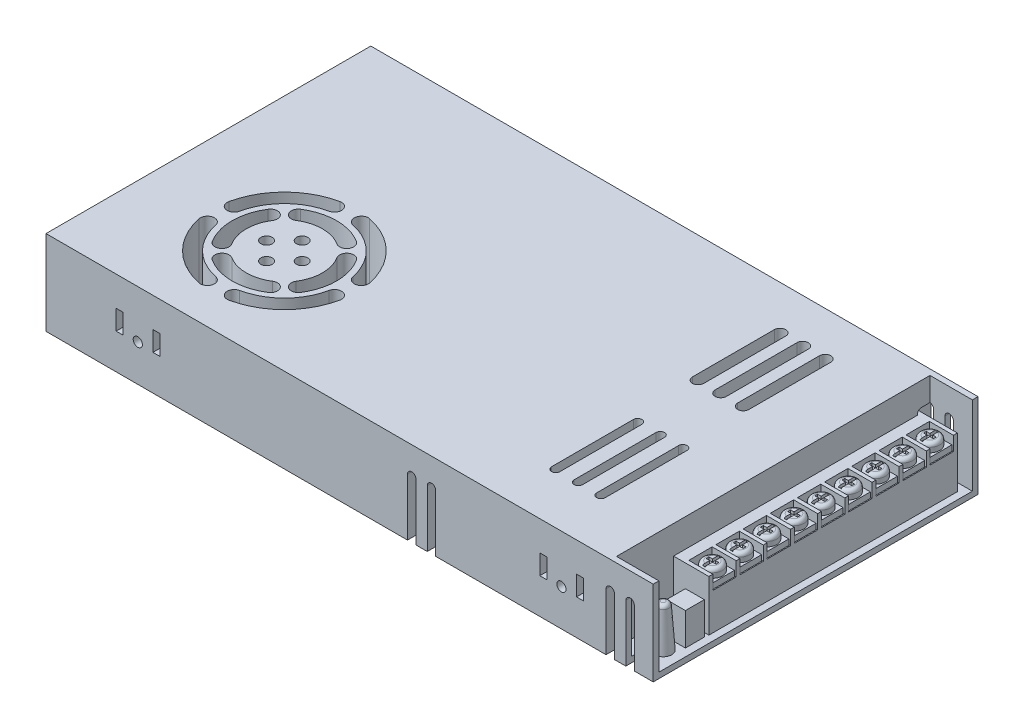
from build123d import *

# Parameters (mm, degrees)
CROQUIS1_W                         = 215
CROQUIS1_H                         = 115
SALIENTE_EXTRUIR1_DEPTH            = 30
CROQUIS2_W                         = 15
CROQUIS2_H                         = 111
CORTAR_EXTRUIR1_DEPTH              = 28
CROQUIS5_R                         = 1.625
CORTAR_EXTRUIR3_DEPTH              = 246.662369931
CORTAR_EXTRUIR5_DEPTH              = 28
CROQUIS10_W                        = 2.5
CROQUIS10_H                        = 7
CORTAR_EXTRUIR8_NO_CONFIRMAT_DEPTH = 246.662369931
CROQUIS11_W                        = 16
CROQUIS11_H                        = 88
SALIENTE_EXTRUIR2_DEPTH            = 20
CROQUIS12_W                        = 8.266666667
CROQUIS12_H                        = 5
CROQUIS12_W_2                      = 8.266666666
CORTAR_EXTRUIR11_DEPTH             = 8.5
CORTAR_EXTRUIR15_DEPTH             = 6.4
CUT_EXTRUDE2_START                 = -110
CUT_EXTRUDE2_DEPTH                 = 10
REDONDEO3_R                        = 1.3
CROQUIS18_R                        = 2
CORTAR_EXTRUIR17_DEPTH             = 28
CROQUIS28_R                        = 1.625
CORTAR_EXTRUIR23_DEPTH             = 2
CROQUIS29_R                        = 3.5
SALIENTE_EXTRUIR3_DEPTH            = 5
REDONDEO4_R                        = 1.3
CROQUIS30_W                        = 1
CROQUIS30_H                        = 6
CORTAR_EXTRUIR24_DEPTH             = 1
CROQUIS31_W                        = 3.5
CROQUIS31_H                        = 1
CORTAR_EXTRUIR25_DEPTH             = 1
CROQUIS32_W                        = 7.8
CROQUIS32_H                        = 7.8
SALIENTE_EXTRUIR4_DEPTH            = 2
MATRIZL1_COUNT                     = 9
MATRIZL1_PITCH                     = 9.62
CROQUIS34_W                        = 6.7
CROQUIS34_H                        = 6.7
SALIENTE_EXTRUIR5_DEPTH            = 11.5
CROQUIS35_R                        = 3
SALIENTE_EXTRUIR6_DEPTH            = 15
SALIENTE_EXTRUIR6_TAPER            = 4
REDONDEO5_R                        = 1.3


with BuildPart() as part:
    # Croquis1 → Saliente-Extruir1 (new body)
    with BuildSketch(Plane(origin=(0, 0, 0), x_dir=(1, 0, 0), z_dir=(0, 1, 0))):
        with Locations((107.5, 57.5)):
            Rectangle(CROQUIS1_W, CROQUIS1_H)
    extrude(amount=SALIENTE_EXTRUIR1_DEPTH)

    # Croquis2 → Cortar-Extruir1 (cut)
    with BuildSketch(Plane(origin=(0, 30, 0), x_dir=(1, 0, 0), z_dir=(0, 1, 0))):
        with Locations((207.5, 57.5)):
            Rectangle(CROQUIS2_W, CROQUIS2_H)
    extrude(amount=-CORTAR_EXTRUIR1_DEPTH, mode=Mode.SUBTRACT)

    # Croquis5 → Cortar-Extruir3 (cut, through all)
    with BuildSketch(Plane(origin=(0, 0, -115), x_dir=(-1, 0, 0), z_dir=(0, 0, -1))):
        with Locations((-182.5, 13)):
            Circle(CROQUIS5_R)
        with Locations((-32.5, 13)):
            Circle(CROQUIS5_R)
    extrude(amount=-CORTAR_EXTRUIR3_DEPTH, mode=Mode.SUBTRACT)

    # Croquis7 → Cortar-Extruir5 (cut)
    with BuildSketch(Plane(origin=(0, 30, 0), x_dir=(1, 0, 0), z_dir=(0, 1, 0))):
        with BuildLine():
            Line((178.4, 99.5), (178.4, 70.5))
            ThreePointArc((178.4, 70.5), (176.4, 68.5), (174.4, 70.5))
            Line((174.4, 70.5), (174.4, 99.5))
            ThreePointArc((174.4, 99.5), (176.4, 101.5), (178.4, 99.5))
        make_face()
        with BuildLine():
            Line((180, 47), (180, 18))
            ThreePointArc((180, 18), (178.5, 16.5), (177, 18))
            Line((177, 18), (177, 47))
            ThreePointArc((177, 47), (178.5, 48.5), (180, 47))
        make_face()
        with BuildLine():
            Line((170.4, 99.5), (170.4, 70.5))
            ThreePointArc((170.4, 70.5), (168.4, 68.5), (166.4, 70.5))
            Line((166.4, 70.5), (166.4, 99.5))
            ThreePointArc((166.4, 99.5), (168.4, 101.5), (170.4, 99.5))
        make_face()
        with BuildLine():
            Line((172, 47), (172, 18))
            ThreePointArc((172, 18), (170.5, 16.5), (169, 18))
            Line((169, 18), (169, 47))
            ThreePointArc((169, 47), (170.5, 48.5), (172, 47))
        make_face()
        with BuildLine():
            Line((162.4, 99.5), (162.4, 70.5))
            ThreePointArc((162.4, 70.5), (160.4, 68.5), (158.4, 70.5))
            Line((158.4, 70.5), (158.4, 99.5))
            ThreePointArc((158.4, 99.5), (160.4, 101.5), (162.4, 99.5))
        make_face()
        with BuildLine():
            Line((164, 47), (164, 18))
            ThreePointArc((164, 18), (162.5, 16.5), (161, 18))
            Line((161, 18), (161, 47))
            ThreePointArc((161, 47), (162.5, 48.5), (164, 47))
        make_face()
    extrude(amount=-CORTAR_EXTRUIR5_DEPTH, mode=Mode.SUBTRACT)

    # Croquis10 → Cortar-Extruir8 (no confirmat) (cut, through all)
    with BuildSketch(Plane(origin=(0, 0, -115), x_dir=(-1, 0, 0), z_dir=(0, 0, -1))):
        with Locations((-26.1, 16)):
            Rectangle(CROQUIS10_W, CROQUIS10_H)
        with Locations((-39.1, 16)):
            Rectangle(CROQUIS10_W, CROQUIS10_H)
        with Locations((-176.1, 16)):
            Rectangle(CROQUIS10_W, CROQUIS10_H)
        with Locations((-189.1, 16)):
            Rectangle(CROQUIS10_W, CROQUIS10_H)
    extrude(amount=-CORTAR_EXTRUIR8_NO_CONFIRMAT_DEPTH, mode=Mode.SUBTRACT)

    # Croquis17 → Cortar-Extruir15 (cut)
    with BuildSketch(Plane(origin=(0, 0, -115), x_dir=(-1, 0, 0), z_dir=(0, 0, -1))):
        with BuildLine():
            Line((-135, 20.2), (-135, 0))
            ThreePointArc((-135, 0), (-136.5, -1.5), (-138, 0))
            Line((-138, 0), (-138, 20.2))
            ThreePointArc((-138, 20.2), (-136.5, 21.7), (-135, 20.2))
        make_face()
        with BuildLine():
            Line((-128, 20.2), (-128, 0))
            ThreePointArc((-128, 0), (-129.5, -1.5), (-131, 0))
            Line((-131, 0), (-131, 20.2))
            ThreePointArc((-131, 20.2), (-129.5, 21.7), (-128, 20.2))
        make_face()
        with BuildLine():
            Line((-201.3, 0), (-201.3, 20.2))
            ThreePointArc((-201.3, 20.2), (-199.8, 21.7), (-198.3, 20.2))
            Line((-198.3, 20.2), (-198.3, 0))
            ThreePointArc((-198.3, 0), (-199.8, -1.5), (-201.3, 0))
        make_face()
        with BuildLine():
            Line((-208.3, 0), (-208.3, 20.2))
            ThreePointArc((-208.3, 20.2), (-206.8, 21.7), (-205.3, 20.2))
            Line((-205.3, 20.2), (-205.3, 0))
            ThreePointArc((-205.3, 0), (-206.8, -1.5), (-208.3, 0))
        make_face()
    extrude(amount=-CORTAR_EXTRUIR15_DEPTH, mode=Mode.SUBTRACT)

    # Croquis17<2> → Cut-Extrude2 (cut)
    with BuildSketch(Plane(origin=(0, 0, -115), x_dir=(-1, 0, 0), z_dir=(0, 0, -1)).offset(CUT_EXTRUDE2_START)):
        with BuildLine():
            Line((-135, 20.2), (-135, 0))
            ThreePointArc((-135, 0), (-136.5, -1.5), (-138, 0))
            Line((-138, 0), (-138, 20.2))
            ThreePointArc((-138, 20.2), (-136.5, 21.7), (-135, 20.2))
        make_face()
        with BuildLine():
            Line((-128, 20.2), (-128, 0))
            ThreePointArc((-128, 0), (-129.5, -1.5), (-131, 0))
            Line((-131, 0), (-131, 20.2))
            ThreePointArc((-131, 20.2), (-129.5, 21.7), (-128, 20.2))
        make_face()
        with BuildLine():
            Line((-201.3, 0), (-201.3, 20.2))
            ThreePointArc((-201.3, 20.2), (-199.8, 21.7), (-198.3, 20.2))
            Line((-198.3, 20.2), (-198.3, 0))
            ThreePointArc((-198.3, 0), (-199.8, -1.5), (-201.3, 0))
        make_face()
        with BuildLine():
            Line((-208.3, 0), (-208.3, 20.2))
            ThreePointArc((-208.3, 20.2), (-206.8, 21.7), (-205.3, 20.2))
            Line((-205.3, 20.2), (-205.3, 0))
            ThreePointArc((-205.3, 0), (-206.8, -1.5), (-208.3, 0))
        make_face()
    extrude(amount=-CUT_EXTRUDE2_DEPTH, mode=Mode.SUBTRACT)

    # Redondeo3
    redondeo3_edges = [part.edges().sort_by_distance(p)[0] for p in [
        (136.5, 21.7, -108.6),
        (135, 10.1, -108.6),
        (138, 10.1, -108.6),
        (129.5, 21.7, -108.6),
        (128, 10.1, -108.6),
        (131, 10.1, -108.6),
        (201.3, 1, -108.6),
        (198.812579117, 21.329158979, -108.6),
        (198.3, 10.1, -108.6),
        (208.3, 1, -108.6),
        (205.3, 1, -108.6),
        (135, 10.1, -5),
        (136.5, 21.7, -5),
        (138, 10.1, -5),
        (128, 10.1, -5),
        (129.5, 21.7, -5),
        (131, 10.1, -5),
        (198.3, 10.1, -5),
        (198.812579117, 21.329158979, -5),
        (201.3, 1, -5),
        (205.3, 1, -5),
        (208.3, 1, -5),
    ]]
    fillet(redondeo3_edges, radius=REDONDEO3_R - 0.0001)  # a hair under: the kernel refuses the full size

    # Croquis18 → Cortar-Extruir17 (cut)
    with BuildSketch(Plane(origin=(0, 30, 0), x_dir=(1, 0, 0), z_dir=(0, 1, 0))):
        with Locations(Location((41.2, 36.9, 0), (0, 0, 270))):
            Circle(CROQUIS18_R)
        with Locations(Location((47.5, 43.2, 0), (0, 0, 270))):
            Circle(CROQUIS18_R)
        with Locations(Location((53.8, 36.9, 0), (0, 0, 270))):
            Circle(CROQUIS18_R)
        with Locations(Location((47.5, 30.6, 0), (0, 0, 270))):
            Circle(CROQUIS18_R)
        with BuildLine():
            ThreePointArc((42.233695652, 61.850271311), (29.46877708, 54.93122292), (22.549728689, 42.166304348))
            ThreePointArc((22.549728689, 42.166304348), (24.479529404, 39.203894963), (27.441938763, 41.133695717))
            ThreePointArc((27.441938763, 41.133695717), (33.004311009, 51.395689038), (43.266304348, 56.95806125))
            ThreePointArc((43.266304348, 56.95806125), (45.196105031, 59.920470629), (42.233695652, 61.850271311))
        make_face()
        with BuildLine():
            ThreePointArc((67.55806125, 41.133695652), (61.995689038, 51.395688991), (51.733695717, 56.958061237))
            ThreePointArc((51.733695717, 56.958061237), (49.803894963, 59.920470596), (52.766304348, 61.850271311))
            ThreePointArc((52.766304348, 61.850271311), (65.53122292, 54.93122292), (72.450271311, 42.166304348))
            ThreePointArc((72.450271311, 42.166304348), (70.520470629, 39.203894969), (67.55806125, 41.133695652))
        make_face()
        with BuildLine():
            ThreePointArc((51.733695652, 16.84193875), (61.995688991, 22.404310962), (67.558061237, 32.666304283))
            ThreePointArc((67.558061237, 32.666304283), (70.520470596, 34.596105037), (72.450271311, 31.633695652))
            ThreePointArc((72.450271311, 31.633695652), (65.53122292, 18.86877708), (52.766304348, 11.949728689))
            ThreePointArc((52.766304348, 11.949728689), (49.803894969, 13.879529371), (51.733695652, 16.84193875))
        make_face()
        with BuildLine():
            ThreePointArc((27.44193875, 32.666304348), (33.004310962, 22.404311009), (43.266304283, 16.841938763))
            ThreePointArc((43.266304283, 16.841938763), (45.196105037, 13.879529404), (42.233695652, 11.949728689))
            ThreePointArc((42.233695652, 11.949728689), (29.46877708, 18.86877708), (22.549728689, 31.633695652))
            ThreePointArc((22.549728689, 31.633695652), (24.479529371, 34.596105031), (27.44193875, 32.666304348))
        make_face()
        with BuildLine():
            ThreePointArc((31.873772868, 46.803081622), (29, 36.9), (31.873772868, 26.996918378))
            ThreePointArc((31.873772868, 26.996918378), (35.323679456, 26.223520336), (36.097077498, 29.673426924))
            ThreePointArc((36.097077498, 29.673426924), (34, 36.9), (36.097077498, 44.126573076))
            ThreePointArc((36.097077498, 44.126573076), (35.323679456, 47.576479664), (31.873772868, 46.803081622))
        make_face()
        with BuildLine():
            ThreePointArc((57.403081622, 52.526227132), (47.5, 55.4), (37.596918378, 52.526227132))
            ThreePointArc((37.596918378, 52.526227132), (36.823520336, 49.076320544), (40.273426924, 48.302922502))
            ThreePointArc((40.273426924, 48.302922502), (47.5, 50.4), (54.726573076, 48.302922502))
            ThreePointArc((54.726573076, 48.302922502), (58.176479664, 49.076320544), (57.403081622, 52.526227132))
        make_face()
        with BuildLine():
            ThreePointArc((63.126227132, 26.996918378), (66, 36.9), (63.126227132, 46.803081622))
            ThreePointArc((63.126227132, 46.803081622), (59.676320544, 47.576479664), (58.902922502, 44.126573076))
            ThreePointArc((58.902922502, 44.126573076), (61, 36.9), (58.902922502, 29.673426924))
            ThreePointArc((58.902922502, 29.673426924), (59.676320544, 26.223520336), (63.126227132, 26.996918378))
        make_face()
        with BuildLine():
            ThreePointArc((37.596918378, 21.273772868), (47.5, 18.4), (57.403081622, 21.273772868))
            ThreePointArc((57.403081622, 21.273772868), (58.176479664, 24.723679456), (54.726573076, 25.497077498))
            ThreePointArc((54.726573076, 25.497077498), (47.5, 23.4), (40.273426924, 25.497077498))
            ThreePointArc((40.273426924, 25.497077498), (36.823520336, 24.723679456), (37.596918378, 21.273772868))
        make_face()
    extrude(amount=-CORTAR_EXTRUIR17_DEPTH, mode=Mode.SUBTRACT)

    # Croquis28 → Cortar-Extruir23 (cut)
    with BuildSketch(Plane.XZ):
        with Locations(Location((30, -32.5, 0), (0, 0, 270))):
            Circle(CROQUIS28_R)
        with Locations(Location((30, -82.5, 0), (0, 0, 270))):
            Circle(CROQUIS28_R)
        with Locations(Location((180, -32.5, 0), (0, 0, 270))):
            Circle(CROQUIS28_R)
        with Locations(Location((180, -82.5, 0), (0, 0, 270))):
            Circle(CROQUIS28_R)
    extrude(amount=-CORTAR_EXTRUIR23_DEPTH, mode=Mode.SUBTRACT)


with BuildPart() as body_2:
    # Croquis11 → Saliente-Extruir2 (new body)
    with BuildSketch(Plane(origin=(0, 0, 0), x_dir=(1, 0, 0), z_dir=(0, 1, 0))):
        with Locations((204.5, 66.2)):
            Rectangle(CROQUIS11_W, CROQUIS11_H)
    extrude(amount=SALIENTE_EXTRUIR2_DEPTH)

    # Croquis12 → Cortar-Extruir11 (cut)
    with BuildSketch(Plane(origin=(212.5, 0, 0), x_dir=(0, 0, -1), z_dir=(1, 0, 0))):
        with Locations((27.733333333, 17.5)):
            Rectangle(CROQUIS12_W, CROQUIS12_H)
        with Locations((37.35, 17.5)):
            Rectangle(CROQUIS12_W_2, CROQUIS12_H)
        with Locations((46.966666667, 17.5)):
            Rectangle(CROQUIS12_W, CROQUIS12_H)
        with Locations((56.583333334, 17.5)):
            Rectangle(CROQUIS12_W, CROQUIS12_H)
        with Locations((66.2, 17.5)):
            Rectangle(CROQUIS12_W_2, CROQUIS12_H)
        with Locations((75.816666666, 17.5)):
            Rectangle(CROQUIS12_W, CROQUIS12_H)
        with Locations((85.433333334, 17.5)):
            Rectangle(CROQUIS12_W, CROQUIS12_H)
        with Locations((95.05, 17.5)):
            Rectangle(CROQUIS12_W_2, CROQUIS12_H)
        with Locations((104.666666667, 17.5)):
            Rectangle(CROQUIS12_W, CROQUIS12_H)
    extrude(amount=-CORTAR_EXTRUIR11_DEPTH, mode=Mode.SUBTRACT)


with BuildPart() as body_3:
    # Croquis29 → Saliente-Extruir3 (new body)
    with BuildSketch(Plane(origin=(0, 15, 0), x_dir=(1, 0, 0), z_dir=(0, 1, 0))):
        with Locations(Location((208.25, 27.733333333, 0), (0, 0, 270))):
            Circle(CROQUIS29_R)
    extrude(amount=SALIENTE_EXTRUIR3_DEPTH)

    # Redondeo4
    redondeo4_edges = [body_3.edges().sort_by_distance(p)[0] for p in [
        (208.25, 20, -31.233333333),
    ]]
    fillet(redondeo4_edges, radius=REDONDEO4_R)

    # Croquis30 → Cortar-Extruir24 (cut)
    with BuildSketch(Plane(origin=(0, 20, 0), x_dir=(1, 0, 0), z_dir=(0, 1, 0))):
        with Locations((208.25, 27.733333333)):
            Rectangle(CROQUIS30_W, CROQUIS30_H)
    extrude(amount=-CORTAR_EXTRUIR24_DEPTH, mode=Mode.SUBTRACT)

    # Croquis31 → Cortar-Extruir25 (cut)
    with BuildSketch(Plane(origin=(0, 20, 0), x_dir=(1, 0, 0), z_dir=(0, 1, 0))):
        with Locations((208.25, 27.733333333)):
            Rectangle(CROQUIS31_W, CROQUIS31_H)
    extrude(amount=-CORTAR_EXTRUIR25_DEPTH, mode=Mode.SUBTRACT)

    # Croquis32 → Saliente-Extruir4 (add)
    with BuildSketch(Plane(origin=(0, 15, 0), x_dir=(1, 0, 0), z_dir=(0, 1, 0))):
        with Locations((208.25, 27.733333333)):
            Rectangle(CROQUIS32_W, CROQUIS32_H)
    extrude(amount=SALIENTE_EXTRUIR4_DEPTH)


with BuildPart() as matrizl1_1:
    # MatrizL1: pattern copy
    add(body_3.part.moved(Location(Vector(0, 0, -1) * (1 * MATRIZL1_PITCH))))


with BuildPart() as matrizl1_2:
    # MatrizL1: pattern copy
    add(body_3.part.moved(Location(Vector(0, 0, -1) * (2 * MATRIZL1_PITCH))))


with BuildPart() as matrizl1_3:
    # MatrizL1: pattern copy
    add(body_3.part.moved(Location(Vector(0, 0, -1) * (3 * MATRIZL1_PITCH))))


with BuildPart() as matrizl1_4:
    # MatrizL1: pattern copy
    add(body_3.part.moved(Location(Vector(0, 0, -1) * (4 * MATRIZL1_PITCH))))


with BuildPart() as matrizl1_5:
    # MatrizL1: pattern copy
    add(body_3.part.moved(Location(Vector(0, 0, -1) * (5 * MATRIZL1_PITCH))))


with BuildPart() as matrizl1_6:
    # MatrizL1: pattern copy
    add(body_3.part.moved(Location(Vector(0, 0, -1) * (6 * MATRIZL1_PITCH))))


with BuildPart() as matrizl1_7:
    # MatrizL1: pattern copy
    add(body_3.part.moved(Location(Vector(0, 0, -1) * (7 * MATRIZL1_PITCH))))


with BuildPart() as matrizl1_8:
    # MatrizL1: pattern copy
    add(body_3.part.moved(Location(Vector(0, 0, -1) * (8 * MATRIZL1_PITCH))))


with BuildPart() as body_12:
    # Croquis34 → Saliente-Extruir5 (new body)
    with BuildSketch(Plane(origin=(0, 2, 0), x_dir=(1, 0, 0), z_dir=(0, 1, 0))):
        with Locations((208.95, 17.45)):
            Rectangle(CROQUIS34_W, CROQUIS34_H)
    extrude(amount=SALIENTE_EXTRUIR5_DEPTH)


with BuildPart() as body_13:
    # Croquis35 → Saliente-Extruir6 (new body)
    with BuildSketch(Plane(origin=(0, 2, 0), x_dir=(1, 0, 0), z_dir=(0, 1, 0))):
        with Locations((208.95, 9.6)):
            Circle(CROQUIS35_R)
    extrude(amount=SALIENTE_EXTRUIR6_DEPTH, taper=SALIENTE_EXTRUIR6_TAPER)

    # Redondeo5
    redondeo5_edges = [body_13.edges().sort_by_distance(p)[0] for p in [
        (206.998902179, 17, -9.6),
    ]]
    fillet(redondeo5_edges, radius=REDONDEO5_R)


solid = Compound([part.part, body_2.part, body_3.part, matrizl1_1.part, matrizl1_2.part, matrizl1_3.part, matrizl1_4.part, matrizl1_5.part, matrizl1_6.part, matrizl1_7.part, matrizl1_8.part, body_12.part, body_13.part])
